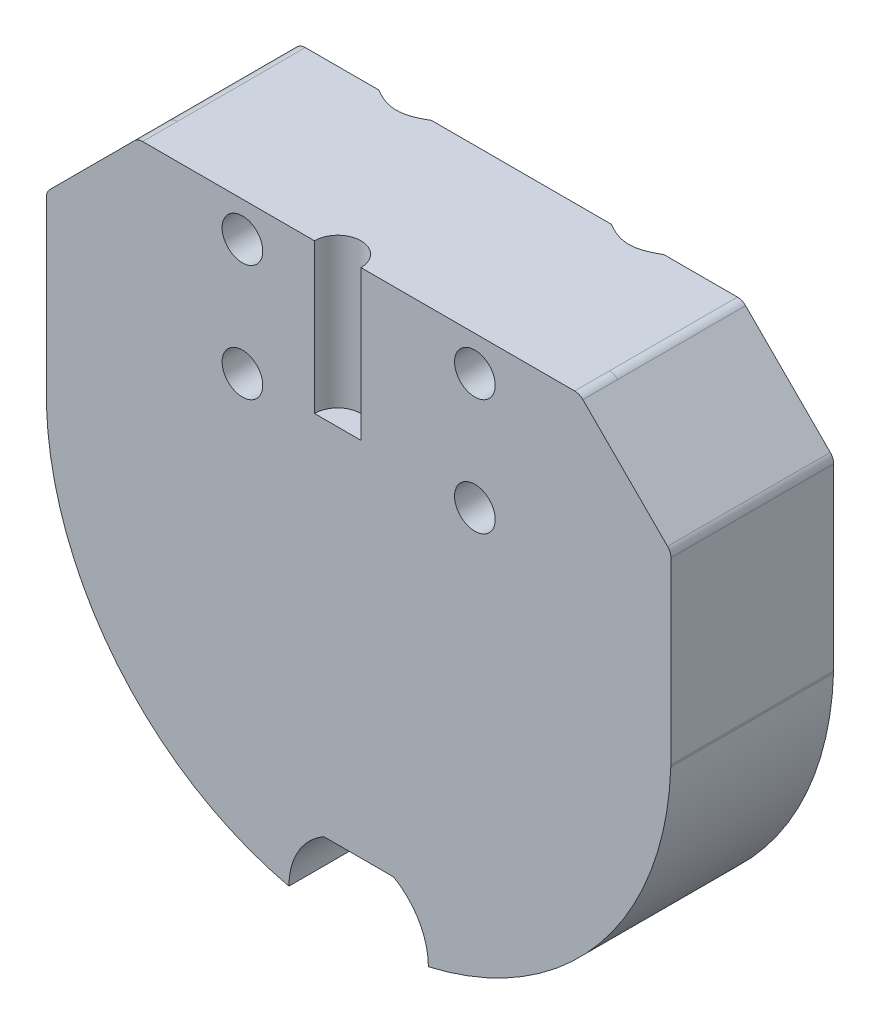
from build123d import *
from build123d.topology import SkipClean

# Parameters (mm, degrees)
CROQUIS3_W                   = 38
CROQUIS3_H                   = 38
SALIENTE_EXTRUIR9_DEPTH      = 1
SALIENTE_EXTRUIR10_START     = -11
SALIENTE_EXTRUIR10_OUTLINE_W = 38
SALIENTE_EXTRUIR10_OUTLINE_H = 38
SALIENTE_EXTRUIR10_DEPTH     = 10
CROQUIS13_W                  = 38
CROQUIS13_H                  = 38
SALIENTE_EXTRUIR15_DEPTH     = 3
CROQUIS14_R                  = 1.75
CORTAR_EXTRUIR1_DEPTH        = 14
CROQUIS15_W                  = 38
CROQUIS15_H                  = 24.129942315
CROQUIS15_R                  = 3.5
SALIENTE_EXTRUIR16_DEPTH     = 1
CORTAR_EXTRUIR2_DEPTH        = 14
SALIENTE_EXTRUIR17_DEPTH     = 5
SALIENTE_EXTRUIR18_DEPTH     = 5
CORTAR_EXTRUIR3_DEPTH        = 3
REDONDEO11_R                 = 1
CROQUIS21_R                  = 1.75
CORTAR_EXTRUIR4_DEPTH        = 11
SALIENTE_EXTRUIR20_START     = 3
CROQUIS22_R                  = 3
CROQUIS22_R_2                = 1.75
SALIENTE_EXTRUIR20_DEPTH     = 3
CHAFL_N1_SIZE                = 2
REDONDEO13_R                 = 1
SALIENTE_EXTRUIR22_DEPTH     = 3
REDONDEO14_R                 = 5
SALIENTE_EXTRUIR25_DEPTH     = 1
SALIENTE_EXTRUIR26_DEPTH     = 13
CROQUIS30_W                  = 12
CROQUIS30_H                  = 8
SALIENTE_EXTRUIR27_DEPTH     = 15
SALIENTE_EXTRUIR28_DEPTH     = 8
CORTAR_EXTRUIR5_DEPTH        = 30
CROQUIS35_R                  = 3
SALIENTE_EXTRUIR29_DEPTH     = 3
CORTAR_EXTRUIR6_DEPTH        = 5


# Read off the part's stored shape, not the designer's step: Saliente-Extruir10
with BuildPart() as part:
    # Croquis3 → Saliente-Extruir9 (new body)
    with BuildSketch(Plane.XY.offset(5)):
        Polygon((19, -5.370057685), (26.870057685, 2.5), (26.870057685, 40.5), (19, 48.370057685), (-19, 48.370057685), (-26.870057685, 40.5), (-26.870057685, 2.5), (-19, -5.370057685), align=None)
        with Locations((0, 21.5)):
            Rectangle(CROQUIS3_W, CROQUIS3_H, mode=Mode.SUBTRACT)
    extrude(amount=-SALIENTE_EXTRUIR9_DEPTH)

    # Saliente-Extruir10 outline → Saliente-Extruir10 (add)
    with BuildSketch(Plane(origin=(0, 0, 4), x_dir=(-1, 0, 0), z_dir=(0, 0, -1)).offset(SALIENTE_EXTRUIR10_START)):
        Polygon((-26.870057685, 2.5), (-19, -5.370057685), (19, -5.370057685), (26.870057685, 2.5), (26.870057685, 40.5), (19, 48.370057685), (-19, 48.370057685), (-26.870057685, 40.5), align=None)
        with Locations((0, 21.5)):
            Rectangle(SALIENTE_EXTRUIR10_OUTLINE_W, SALIENTE_EXTRUIR10_OUTLINE_H, mode=Mode.SUBTRACT)
    extrude(amount=SALIENTE_EXTRUIR10_DEPTH)

    # Croquis13 → Saliente-Extruir15 (add)
    with BuildSketch(Plane.XY.offset(15)):
        with BuildLine():
            Line((-22.5, 44.870057685), (-22.5, -1))
            Line((-22.5, -1), (22.5, -1))
            Line((22.5, -1), (22.5, 44.870057685))
            Line((22.5, 44.870057685), (19.292893219, 48.077164466))
            ThreePointArc((19.292893219, 48.077164466), (18.96846987, 48.293937218), (18.585786438, 48.370057685))
            Line((18.585786438, 48.370057685), (-18.585786438, 48.370057685))
            ThreePointArc((-18.585786438, 48.370057685), (-18.96846987, 48.293937218), (-19.292893219, 48.077164466))
            Line((-19.292893219, 48.077164466), (-22.5, 44.870057685))
        make_face()
        with Locations((0, 21.5)):
            Rectangle(CROQUIS13_W, CROQUIS13_H, mode=Mode.SUBTRACT)
    extrude(amount=SALIENTE_EXTRUIR15_DEPTH)

    # Croquis14 → Cortar-Extruir1 (cut)
    with BuildSketch(Plane(origin=(0, 0, 4), x_dir=(-1, 0, 0), z_dir=(0, 0, -1))):
        with Locations((10, 45.37415474)):
            Circle(CROQUIS14_R)
        with Locations(Location((-10, 45.37415474, 0), (0, 0, 180))):
            Circle(CROQUIS14_R)
    extrude(amount=-CORTAR_EXTRUIR1_DEPTH, mode=Mode.SUBTRACT)

    # Croquis15 → Saliente-Extruir16 (add)
    with BuildSketch(Plane(origin=(0, 0, 4), x_dir=(-1, 0, 0), z_dir=(0, 0, -1))):
        with Locations((0, 28.435028843)):
            Rectangle(CROQUIS15_W, CROQUIS15_H)
        with Locations((0, 25.370057685)):
            Circle(CROQUIS15_R, mode=Mode.SUBTRACT)
    extrude(amount=-SALIENTE_EXTRUIR16_DEPTH)

    # Croquis16 → Cortar-Extruir2 (cut)
    with BuildSketch(Plane(origin=(0, 0, 4), x_dir=(-1, 0, 0), z_dir=(0, 0, -1))):
        Polygon((-19, 2.5), (-19, 16.370057685), (-26.870057685, 24.24011537), (-26.870057685, 2.5), (-19, -5.370057685), (19, -5.370057685), (26.870057685, 2.5), (26.870057685, 24.24011537), (19, 16.370057685), (19, 2.5), align=None)
    extrude(amount=-CORTAR_EXTRUIR2_DEPTH, mode=Mode.SUBTRACT)

    # Croquis17 → Saliente-Extruir17 (add)
    with BuildSketch(Plane.XY.offset(5)):
        Polygon((6, 31.370057685), (6, 25.370057685), (6, 19.370057685), (6, 16.370057685), (19, 16.370057685), (19, 40.5), (-19, 40.5), (-19, 16.370057685), (-6, 16.370057685), (-6, 19.370057685), (-6, 31.370057685), align=None)
    extrude(amount=SALIENTE_EXTRUIR17_DEPTH)

    # Croquis18 → Saliente-Extruir18 (add)
    with BuildSketch(Plane.XY.offset(10)):
        Polygon((-19, 40.5), (-19, 16.370057685), (-6, 16.370057685), (-6, 19.370057685), (6, 19.370057685), (6, 16.370057685), (19, 16.370057685), (19, 40.5), align=None)
    extrude(amount=SALIENTE_EXTRUIR18_DEPTH)

    # Croquis19 → Cortar-Extruir3 (cut)
    with BuildSketch(Plane.XY.offset(18)):
        Polygon((-22.5, 19.870057685), (-19, 16.370057685), (-19, 21.370057685), (-22.5, 21.370057685), align=None)
        Polygon((19, 16.370057685), (22.5, 19.870057685), (22.5, 21.370057685), (19, 21.370057685), align=None)
    extrude(amount=-CORTAR_EXTRUIR3_DEPTH, mode=Mode.SUBTRACT)

    # Redondeo11
    redondeo11_edges = [part.edges().sort_by_distance(p)[0] for p in [
        (26.870057685, 40.5, 10),
        (19, 48.370057685, 10),
        (-19, 48.370057685, 10),
        (-26.870057685, 40.5, 10),
        (26.870057685, 24.24011537, 9.5),
        (19, 16.370057685, 9.5),
        (-26.870057685, 24.24011537, 9.5),
        (-19, 16.370057685, 9.5),
    ]]
    fillet(redondeo11_edges, radius=REDONDEO11_R)

    # Croquis21 → Cortar-Extruir4 (cut)
    with BuildSketch(Plane.XY.offset(15)):
        with Locations((-10, 35.37415474)):
            Circle(CROQUIS21_R)
        with Locations((10, 35.37415474)):
            Circle(CROQUIS21_R)
    extrude(amount=-CORTAR_EXTRUIR4_DEPTH, mode=Mode.SUBTRACT)

    # Croquis22 → Saliente-Extruir20 (add)
    # profile 1 of 2: a face of its own
    with BuildSketch(Plane.XY.offset(15).offset(SALIENTE_EXTRUIR20_START)):
        with Locations(Location((-10, 35.37415474, 0), (0, 0, 180))):
            Circle(CROQUIS22_R)
        with Locations((-10, 35.37415474)):
            Circle(CROQUIS22_R_2, mode=Mode.SUBTRACT)
    # profile 2 of 2: a face of its own
    with BuildSketch(Plane.XY.offset(15).offset(SALIENTE_EXTRUIR20_START)):
        with Locations(Location((10, 35.37415474, 0), (0, 0, 180))):
            Circle(CROQUIS22_R)
        with Locations((10, 35.37415474)):
            Circle(CROQUIS22_R_2, mode=Mode.SUBTRACT)
    extrude(amount=-SALIENTE_EXTRUIR20_DEPTH)

    # Croquis23 → Cortar-Revolución1 (revolve, cut)
    with BuildSketch(Plane.XY.offset(18)):
        Polygon((-1.8, 48.370057685), (-1.8, 44.97415474), (-1.8, 40.5), (0.2, 40.5), (0.2, 48.370057685), align=None)
    revolve(axis=Axis((-1.8, 44.97415474, 18), (0, 1, 0)), mode=Mode.SUBTRACT)

    # Chaflán1
    # the kernel refuses this chamfer: 2 mm, written as the material it takes off along each edge
    with BuildSketch(Plane(origin=(-10, 45.37415474, 4), x_dir=(-1, 0, 0), z_dir=(0, -1, 0))) as chafl_n1_piece_1:
        Polygon((1.75 + CHAFL_N1_SIZE, 0), (1.75, -CHAFL_N1_SIZE), (1.75, 0), align=None)
    revolve(axis=Axis((-10, 45.37415474, 4), (0, 0, -1)), mode=Mode.SUBTRACT)
    with BuildSketch(Plane(origin=(10, 45.37415474, 4), x_dir=(1, 0, 0), z_dir=(0, 1, 0))) as chafl_n1_piece_2:
        Polygon((1.75 + CHAFL_N1_SIZE, 0), (1.75, -CHAFL_N1_SIZE), (1.75, 0), align=None)
    revolve(axis=Axis((10, 45.37415474, 4), (0, 0, -1)), mode=Mode.SUBTRACT)
    with BuildSketch(Plane(origin=(-10, 35.37415474, 4), x_dir=(1, 0, 0), z_dir=(0, -1, 0))) as chafl_n1_piece_3:
        Polygon((1.75 + CHAFL_N1_SIZE, 0), (1.75, CHAFL_N1_SIZE), (1.75, 0), align=None)
    revolve(axis=Axis((-10, 35.37415474, 4), (0, 0, 1)), mode=Mode.SUBTRACT)
    with BuildSketch(Plane(origin=(10, 35.37415474, 4), x_dir=(1, 0, 0), z_dir=(0, -1, 0))) as chafl_n1_piece_4:
        Polygon((1.75 + CHAFL_N1_SIZE, 0), (1.75, CHAFL_N1_SIZE), (1.75, 0), align=None)
    revolve(axis=Axis((10, 35.37415474, 4), (0, 0, 1)), mode=Mode.SUBTRACT)

    # Redondeo13
    redondeo13_edges = [part.edges().sort_by_distance(p)[0] for p in [
        (22.5, 21.370057685, 16.5),
        (19, 21.370057685, 16.5),
        (-19, 21.370057685, 16.5),
        (-22.5, 21.370057685, 16.5),
    ]]
    fillet(redondeo13_edges, radius=REDONDEO13_R)

    # Croquis26 → Saliente-Extruir22 (add)
    with BuildSketch(Plane.XY.offset(15)):
        with BuildLine():
            Line((19, 22.370057685), (-19, 22.370057685))
            ThreePointArc((-19, 22.370057685), (-19.292893219, 21.662950904), (-20, 21.370057685))
            Line((-20, 21.370057685), (-21.5, 21.370057685))
            ThreePointArc((-21.5, 21.370057685), (-22.207106781, 21.662950904), (-22.5, 22.370057685))
            Line((-22.5, 22.370057685), (-22.5, 44.870057685))
            Line((-22.5, 44.870057685), (-26.577164466, 40.792893219))
            ThreePointArc((-26.577164466, 40.792893219), (-26.793937218, 40.46846987), (-26.870057685, 40.085786438))
            Line((-26.870057685, 40.085786438), (-26.870057685, 24.654328933))
            ThreePointArc((-26.870057685, 24.654328933), (-26.793937218, 24.2716455), (-26.577164466, 23.947222151))
            Line((-26.577164466, 23.947222151), (-19.292893219, 16.662950904))
            ThreePointArc((-19.292893219, 16.662950904), (-18.96846987, 16.446178153), (-18.585786438, 16.370057685))
            Line((-18.585786438, 16.370057685), (-6, 16.370057685))
            Line((-6, 16.370057685), (-6, 19.370057685))
            Line((-6, 19.370057685), (6, 19.370057685))
            Line((6, 19.370057685), (6, 16.370057685))
            Line((6, 16.370057685), (18.585786438, 16.370057685))
            ThreePointArc((18.585786438, 16.370057685), (18.96846987, 16.446178153), (19.292893219, 16.662950904))
            Line((19.292893219, 16.662950904), (26.577164466, 23.947222151))
            ThreePointArc((26.577164466, 23.947222151), (26.793937218, 24.2716455), (26.870057685, 24.654328933))
            Line((26.870057685, 24.654328933), (26.870057685, 40.085786438))
            ThreePointArc((26.870057685, 40.085786438), (26.793937218, 40.46846987), (26.577164466, 40.792893219))
            Line((26.577164466, 40.792893219), (22.5, 44.870057685))
            Line((22.5, 44.870057685), (22.5, 22.370057685))
            ThreePointArc((22.5, 22.370057685), (22.207106781, 21.662950904), (21.5, 21.370057685))
            Line((21.5, 21.370057685), (20, 21.370057685))
            ThreePointArc((20, 21.370057685), (19.292893219, 21.662950904), (19, 22.370057685))
        make_face()
    extrude(amount=SALIENTE_EXTRUIR22_DEPTH)

    # Redondeo14
    redondeo14_edges = [part.edges().sort_by_distance(p)[0] for p in [
        (-19, 40.5, 16.5),
        (19, 40.5, 16.5),
        (19, 22.370057685, 16.5),
        (-19, 22.370057685, 16.5),
    ]]
    fillet(redondeo14_edges, radius=REDONDEO14_R)

    # Croquis28 → Saliente-Extruir25 (add)
    with BuildSketch(Plane(origin=(0, 0, 4), x_dir=(-1, 0, 0), z_dir=(0, 0, -1))):
        with BuildLine():
            ThreePointArc((-26.855444452, 24.483997139), (0, -1.5), (26.855444452, 24.483997139))
            ThreePointArc((26.855444452, 24.483997139), (26.757844512, 24.194074057), (26.577164466, 23.947222151))
            Line((26.577164466, 23.947222151), (19.292893219, 16.662950904))
            ThreePointArc((19.292893219, 16.662950904), (18.96846987, 16.446178153), (18.585786438, 16.370057685))
            Line((18.585786438, 16.370057685), (-18.585786438, 16.370057685))
            ThreePointArc((-18.585786438, 16.370057685), (-18.96846987, 16.446178153), (-19.292893219, 16.662950904))
            Line((-19.292893219, 16.662950904), (-26.577164466, 23.947222151))
            ThreePointArc((-26.577164466, 23.947222151), (-26.757844512, 24.194074057), (-26.855444452, 24.483997139))
        make_face()
    extrude(amount=-SALIENTE_EXTRUIR25_DEPTH)

    # Croquis29 → Saliente-Extruir26 (add)
    with BuildSketch(Plane.XY.offset(5)):
        with BuildLine():
            Line((-6, 16.370057685), (-6, -0.821544022))
            ThreePointArc((-6, -0.821544022), (-20.735541008, 8.280957677), (-26.855444452, 24.483997139))
            Line((-26.855444452, 24.483997139), (-6, 16.370057685))
        make_face()
        with BuildLine():
            Line((6, 16.370057685), (6, -0.821544022))
            ThreePointArc((6, -0.821544022), (20.735541008, 8.280957677), (26.855444452, 24.483997139))
            Line((26.855444452, 24.483997139), (6, 16.370057685))
        make_face()
    extrude(amount=SALIENTE_EXTRUIR26_DEPTH)

    # Croquis30 → Saliente-Extruir27 (add)
    with BuildSketch(Plane.XZ.offset(-19.370057685)):
        with Locations((0, 14)):
            Rectangle(CROQUIS30_W, CROQUIS30_H)
    extrude(amount=SALIENTE_EXTRUIR27_DEPTH)

    # Croquis31 → Saliente-Extruir28 (add)
    with BuildSketch(Plane.XY.offset(18)):
        with BuildLine():
            ThreePointArc((-6, -0.821544022), (-4.242640687, 3.421096665), (0, 5.178455978))
            Line((0, 5.178455978), (-6, 5.178455978))
            Line((-6, 5.178455978), (-6, -0.821544022))
        make_face()
        with BuildLine():
            Line((6, 5.178455978), (0, 5.178455978))
            ThreePointArc((0, 5.178455978), (4.242640687, 3.421096665), (6, -0.821544022))
            Line((6, -0.821544022), (6, 5.178455978))
        make_face()
    extrude(amount=-SALIENTE_EXTRUIR28_DEPTH)

    # Croquis34 → Cortar-Extruir5 (cut)
    with BuildSketch(Plane(origin=(0, -1.5, 0), x_dir=(-1, 0, 0), z_dir=(0, -1, 0))):
        Polygon((9.602722226, -7.5), (10.877722226, -4), (15.977722226, -4), (17.252722226, -7.5), (18.527722226, -11), (8.327722226, -11), align=None)
        Polygon((-10.877722226, -4), (-9.602722226, -7.5), (-8.327722226, -11), (-18.527722226, -11), (-17.252722226, -7.5), (-15.977722226, -4), align=None)
    extrude(amount=-CORTAR_EXTRUIR5_DEPTH, mode=Mode.SUBTRACT)

    # Croquis35 → Saliente-Extruir29 (add)
    with BuildSketch(Plane.XY.offset(15)):
        with BuildLine():
            Line((-14, 40.5), (14, 40.5))
            ThreePointArc((14, 40.5), (17.535533906, 39.035533906), (19, 35.5))
            Line((19, 35.5), (19, 27.370057685))
            ThreePointArc((19, 27.370057685), (17.535533906, 23.834523779), (14, 22.370057685))
            Line((14, 22.370057685), (-14, 22.370057685))
            ThreePointArc((-14, 22.370057685), (-17.535533906, 23.834523779), (-19, 27.370057685))
            Line((-19, 27.370057685), (-19, 35.5))
            ThreePointArc((-19, 35.5), (-17.535533906, 39.035533906), (-14, 40.5))
        make_face()
        with Locations((-10, 35.37415474)):
            Circle(CROQUIS35_R, mode=Mode.SUBTRACT)
        with Locations((10, 35.37415474)):
            Circle(CROQUIS35_R, mode=Mode.SUBTRACT)
    extrude(amount=SALIENTE_EXTRUIR29_DEPTH)

    # Croquis36 → Cortar-Extruir6 (cut)
    with SkipClean():  # the faces are left unmerged after this step: merging them gives an invalid solid
        with BuildSketch(Plane(origin=(0, 40.5, 0), x_dir=(1, 0, 0), z_dir=(0, 1, 0))):
            with BuildLine():
                Line((0.2, -18), (-3.8, -18))
                ThreePointArc((-3.8, -18), (-1.8, -16), (0.2, -18))
            make_face()
        extrude(amount=-CORTAR_EXTRUIR6_DEPTH, mode=Mode.SUBTRACT)
    add(part.part.scale(1), mode=Mode.REPLACE)  # the faces are merged on a copy


solid = part.part
